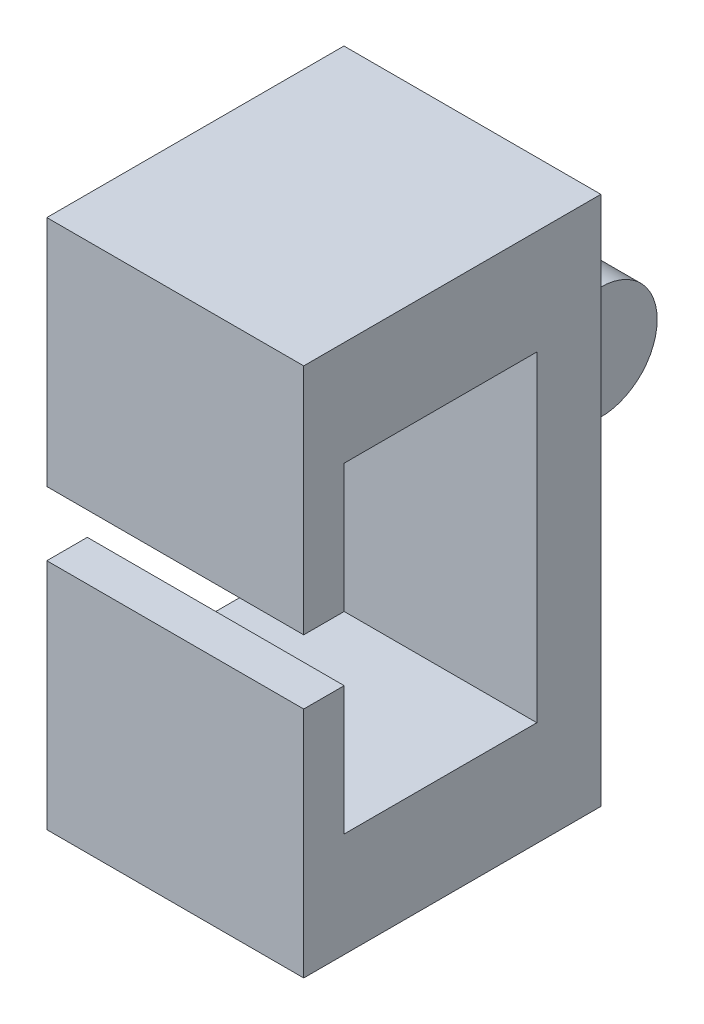
from build123d import *

# Parameters (mm, degrees)
SKETCH1_R           = 11.136121628
BOSS_EXTRUDE1_DEPTH = 25.4
SKETCH2_W           = 22.261321628
SKETCH2_H           = 25.4
BOSS_EXTRUDE2_DEPTH = 3.834635566
SKETCH3_W           = 63.5
SKETCH3_H           = 12.654490516
BOSS_EXTRUDE3_DEPTH = 50.8
SKETCH4_W           = 20.664696479
SKETCH4_H           = 50.754490516
BOSS_EXTRUDE4_DEPTH = 50.8
SKETCH5_W           = 46.064696479
SKETCH5_H           = 8.003402532
BOSS_EXTRUDE5_DEPTH = 50.8


with BuildPart() as part:
    # Sketch1 → Boss-Extrude1 (new body)
    with BuildSketch(Plane.YZ):
        Circle(SKETCH1_R)
    extrude(amount=BOSS_EXTRUDE1_DEPTH)

    # Sketch2 → Boss-Extrude2 (add)
    with BuildSketch(Plane(origin=(0, 0, 0), x_dir=(0, -1, 0), z_dir=(-1, 0, 0))):
        with Locations((-0.005460814, 12.7)):
            Rectangle(SKETCH2_W, SKETCH2_H)
    extrude(amount=-BOSS_EXTRUDE2_DEPTH)

    # Sketch3 → Boss-Extrude3 (add)
    with BuildSketch(Plane.YZ):
        with Locations((0, 31.727245258)):
            Rectangle(SKETCH3_W, SKETCH3_H)
    extrude(amount=BOSS_EXTRUDE3_DEPTH)

    # Sketch4 → Boss-Extrude4 (add)
    with BuildSketch(Plane.YZ):
        with Locations((-42.082348239, 50.777245258)):
            Rectangle(SKETCH4_W, SKETCH4_H)
        with Locations((42.082348239, 50.777245258)):
            Rectangle(SKETCH4_W, SKETCH4_H)
    extrude(amount=BOSS_EXTRUDE4_DEPTH)

    # Sketch5 → Boss-Extrude5 (add)
    with BuildSketch(Plane.YZ):
        with Locations((-29.38234824, 80.156191782)):
            Rectangle(SKETCH5_W, SKETCH5_H)
        with Locations((29.38234824, 80.156191782)):
            Rectangle(SKETCH5_W, SKETCH5_H)
    extrude(amount=BOSS_EXTRUDE5_DEPTH)


solid = part.part
